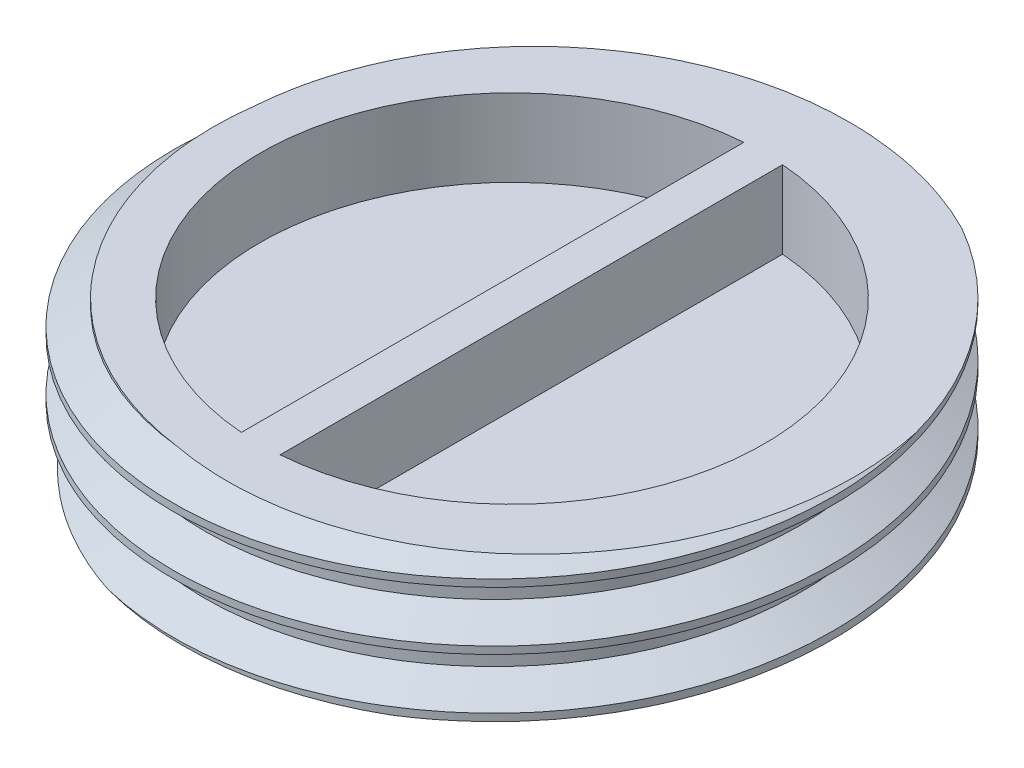
from build123d import *

# Parameters (mm, degrees)
SKETCH1_R           = 8.5
BOSS_EXTRUDE1_DEPTH = 1.5
BOSS_EXTRUDE2_DEPTH = 2
THREAD3_PITCH       = 1.5


with BuildPart() as part:
    # Sketch1 → Boss-Extrude1 (new body)
    with BuildSketch(Plane(origin=(0, 0, 0), x_dir=(1, 0, 0), z_dir=(0, 1, 0))):
        with Locations(Location((0, 0, 0), (0, 0, 270))):
            Circle(SKETCH1_R)
    extrude(amount=BOSS_EXTRUDE1_DEPTH)

    # Sketch2 → Boss-Extrude2 (add)
    with BuildSketch(Plane(origin=(0, 1.5, 0), x_dir=(1, 0, 0), z_dir=(0, 1, 0))):
        with BuildLine():
            Line((-0.5, 6.480740698), (-0.5, 8.485281374))
            ThreePointArc((-0.5, 8.485281374), (-8.5, 0), (-0.5, -8.485281374))
            Line((-0.5, -8.485281374), (-0.5, -6.480740698))
            ThreePointArc((-0.5, -6.480740698), (-6.5, 0), (-0.5, 6.480740698))
        make_face()
        with BuildLine():
            ThreePointArc((0.5, 8.485281374), (0, 8.5), (-0.5, 8.485281374))
            Line((-0.5, 8.485281374), (-0.5, 6.480740698))
            ThreePointArc((-0.5, 6.480740698), (0, 6.5), (0.5, 6.480740698))
            Line((0.5, 6.480740698), (0.5, 8.485281374))
        make_face()
        with BuildLine():
            Line((-0.5, -6.480740698), (-0.5, -8.485281374))
            ThreePointArc((-0.5, -8.485281374), (0, -8.5), (0.5, -8.485281374))
            Line((0.5, -8.485281374), (0.5, -6.480740698))
            ThreePointArc((0.5, -6.480740698), (0, -6.5), (-0.5, -6.480740698))
        make_face()
        with BuildLine():
            ThreePointArc((8.5, 0), (6.184658438, 5.830951895), (0.5, 8.485281374))
            Line((0.5, 8.485281374), (0.5, 6.480740698))
            ThreePointArc((0.5, 6.480740698), (4.769696007, 4.415880433), (6.5, 0))
            ThreePointArc((6.5, 0), (4.769696007, -4.415880433), (0.5, -6.480740698))
            Line((0.5, -6.480740698), (0.5, -8.485281374))
            ThreePointArc((0.5, -8.485281374), (6.184658438, -5.830951895), (8.5, 0))
        make_face()
        with BuildLine():
            ThreePointArc((0.5, 6.480740698), (0, 6.5), (-0.5, 6.480740698))
            Line((-0.5, 6.480740698), (-0.5, -6.480740698))
            ThreePointArc((-0.5, -6.480740698), (0, -6.5), (0.5, -6.480740698))
            Line((0.5, -6.480740698), (0.5, 6.480740698))
        make_face()
    extrude(amount=BOSS_EXTRUDE2_DEPTH)

    # Thread3: the profile of Thread Profile3 profile screwed along a right-hand helix of 6.666667 turns, 8 arcs to a turn; built about Z, then put on its axis
    thread3_z = Axis((0, 0, 0), (0, 0, 1))
    thread3_corners = [(8.5003, 0, -0.000173205), (8.5003, 0, 1.312673201), (7.688101188, 0, 0.843749998), (7.688101188, 0, 0.468749998)]
    with BuildLine(mode=Mode.PRIVATE) as thread3_profile:
        Line(thread3_corners[0], thread3_corners[1])
        Line(thread3_corners[1], thread3_corners[2])
        Line(thread3_corners[2], thread3_corners[3])
        Line(thread3_corners[3], thread3_corners[0])
    thread3_cap = Face(thread3_profile.wire())
    thread3_turn_angles = [0, 22.5, 45, 67.5, 90, 112.5, 135, 157.5, 180, 202.5, 225, 247.5, 270, 292.5, 315, 337.5, 360]
    thread3_turn_weights = [1, 0.9238795325112867, 1, 0.9238795325112867, 1, 0.9238795325112867, 1, 0.9238795325112867, 1, 0.9238795325112867, 1, 0.9238795325112867, 1, 0.9238795325112867, 1, 0.9238795325112867, 1]
    thread3_turn_rails = [Edge.make_bspline([Vector(p[0], p[1], 0).rotate(thread3_z, thread3_turn_angles[k]) / thread3_turn_weights[k] + Vector(0, 0, p[2] + THREAD3_PITCH * thread3_turn_angles[k] / 360) for k in range(17)], [0, 0, 0, 1, 1, 2, 2, 3, 3, 4, 4, 5, 5, 6, 6, 7, 7, 8, 8, 8], 2, thread3_turn_weights) for p in thread3_corners]
    thread3_turn_sides = [Face.make_surface_from_curves(thread3_turn_rails[p[0]], thread3_turn_rails[p[1]]) for p in [(0, 1), (1, 2), (2, 3), (3, 0)]]
    thread3_last_angles = [2160, 2182.5, 2205, 2227.5, 2250, 2272.5, 2295, 2317.5, 2340, 2362.5, 2385, 2392.5, 2400]
    thread3_last_weights = [1, 0.9238795325112867, 1, 0.9238795325112867, 1, 0.9238795325112867, 1, 0.9238795325112867, 1, 0.9238795325112867, 1, 0.9914448613738109, 1]
    thread3_last_rails = [Edge.make_bspline([Vector(p[0], p[1], 0).rotate(thread3_z, thread3_last_angles[k]) / thread3_last_weights[k] + Vector(0, 0, p[2] + THREAD3_PITCH * thread3_last_angles[k] / 360) for k in range(13)], [0, 0, 0, 1, 1, 2, 2, 3, 3, 4, 4, 5, 5, 6, 6, 6], 2, thread3_last_weights) for p in thread3_corners]
    thread3_last_sides = [Face.make_surface_from_curves(thread3_last_rails[p[0]], thread3_last_rails[p[1]]) for p in [(0, 1), (1, 2), (2, 3), (3, 0)]]
    thread3 = Plane(origin=(0, 5.5, 0), x_dir=(-1, 0, 0), z_dir=(0, -1, 0)) * Solid(Shell([*[p.moved(Location((0, 0, THREAD3_PITCH * i))) for i in range(6) for p in thread3_turn_sides], *thread3_last_sides, thread3_cap, thread3_cap.rotate(thread3_z, 2400).moved(Location((0, 0, THREAD3_PITCH * 2400 / 360)))]))
    add(thread3, mode=Mode.SUBTRACT)


solid = part.part
